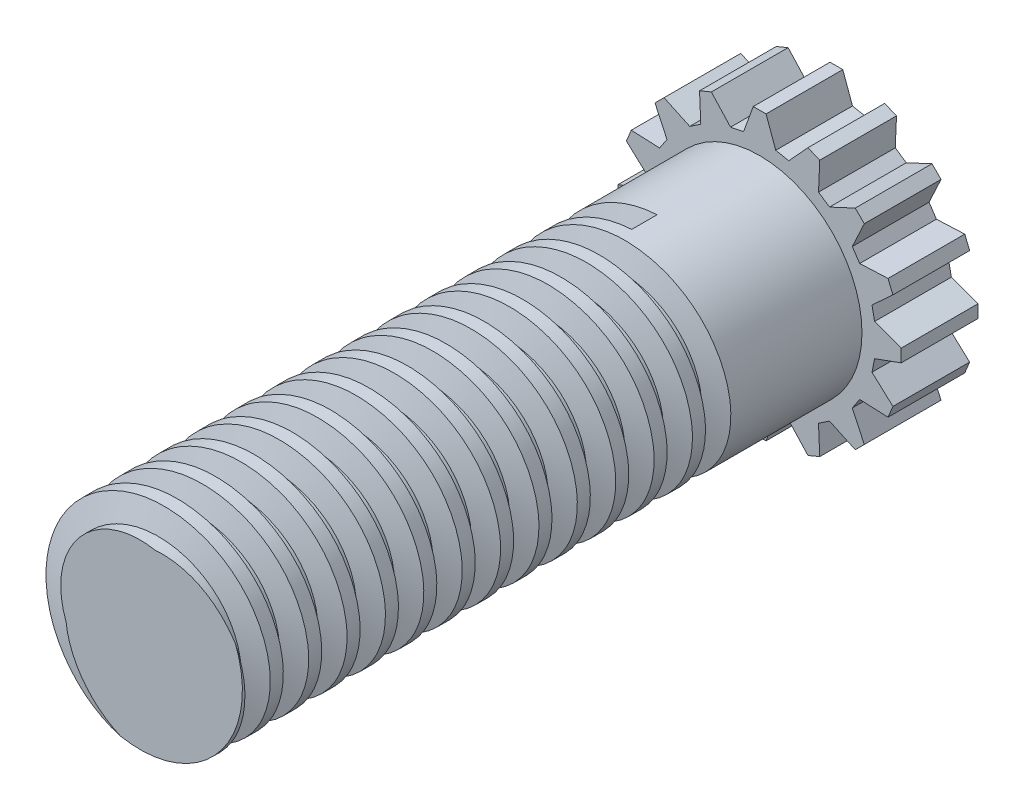
from build123d import *
from build123d.topology import SkipClean

# Parameters (mm, degrees)
SKETCH_1_R               = 4
EXTRUDE_1_DEPTH          = 30
EXTRUDE_START            = 5
SKETCH_4_R               = 4
EXTRUDE_2_DEPTH          = 5
SKETCH_5_R               = 4
EXTRUDE_3_DEPTH          = 5
SWEEP_1_PITCH            = 1.5
SKETCH_6_R               = 2
EXTRUDE_1_2_DEPTH        = 3
CUT_EXTRUDE_1_DEPTH      = 36.864400436
CUT_EXTRUDE_1_DEPTH_BACK = 36.864400436
SKETCH_8_W               = 23.396667725
SKETCH_8_H               = 18.619103895


with BuildPart() as part:
    # 草图1 → Extrude 1 (new body)
    with BuildSketch(Plane.XY):
        Circle(SKETCH_1_R)
    extrude(amount=EXTRUDE_1_DEPTH)

    # 草图4 → 拉伸2 (add)
    with BuildSketch(Plane(origin=(0, 0, 0), x_dir=(-1, 0, 0), z_dir=(0, 0, -1)).offset(EXTRUDE_START)):
        Circle(SKETCH_4_R)
    extrude(amount=-EXTRUDE_2_DEPTH)

    # 草图5 → 拉伸3 (add)
    with BuildSketch(Plane.XY.offset(30)):
        with Locations(Location((0, 0, 0), (0, 0, 180))):
            Circle(SKETCH_5_R)
    extrude(amount=EXTRUDE_3_DEPTH)

    # 切除-扫描1: the profile of 草图2 profile screwed along a right-hand helix of 20 turns, 6 arcs to a turn; built about Z, then put on its axis
    with SkipClean():  # the faces are left unmerged after this step: merging them gives an invalid solid
        sweep_1_z = Axis((0, 0, 0), (0, 0, 1))
        sweep_1_corners = [(4.0003, 0, 8.0385e-05), (4.0003, 0, -0.991234658), (3.1, 0, -0.75), (3.1, 0, -0.241154273)]
        with BuildLine(mode=Mode.PRIVATE) as sweep_1_profile:
            Line(sweep_1_corners[0], sweep_1_corners[1])
            Line(sweep_1_corners[1], sweep_1_corners[2])
            Line(sweep_1_corners[2], sweep_1_corners[3])
            Line(sweep_1_corners[3], sweep_1_corners[0])
        sweep_1_cap = Face(sweep_1_profile.wire())
        sweep_1_turn_angles = [0, 30, 60, 90, 120, 150, 180, 210, 240, 270, 300, 330, 360]
        sweep_1_turn_weights = [1, 0.8660254037844387, 1, 0.8660254037844387, 1, 0.8660254037844387, 1, 0.8660254037844387, 1, 0.8660254037844387, 1, 0.8660254037844387, 1]
        sweep_1_turn_rails = [Edge.make_bspline([Vector(p[0], p[1], 0).rotate(sweep_1_z, sweep_1_turn_angles[k]) / sweep_1_turn_weights[k] + Vector(0, 0, p[2] + SWEEP_1_PITCH * sweep_1_turn_angles[k] / 360) for k in range(13)], [0, 0, 0, 1, 1, 2, 2, 3, 3, 4, 4, 5, 5, 6, 6, 6], 2, sweep_1_turn_weights) for p in sweep_1_corners]
        sweep_1_turn_sides = [Face.make_surface_from_curves(sweep_1_turn_rails[p[0]], sweep_1_turn_rails[p[1]]) for p in [(0, 1), (1, 2), (2, 3), (3, 0)]]
        sweep_1 = Plane(origin=(0, 0, 0), x_dir=(0, 1, 0), z_dir=(0, 0, 1)) * Solid(Shell([*[p.moved(Location((0, 0, SWEEP_1_PITCH * i))) for i in range(20) for p in sweep_1_turn_sides], sweep_1_cap, sweep_1_cap.rotate(sweep_1_z, 7200).moved(Location((0, 0, SWEEP_1_PITCH * 7200 / 360)))]))
        add(sweep_1, mode=Mode.SUBTRACT)

    # 草图6 → Extrude 1 2 (add)
    with SkipClean():  # the faces are left unmerged after this step: merging them gives an invalid solid
        with BuildSketch(Plane(origin=(0, 0, -5), x_dir=(-1, 0, 0), z_dir=(0, 0, -1))):
            Polygon((-0.25, 5.534221656), (0.25, 5.534221656), (0.629149094, 4.492518082), (1.137954269, 4.39131044), (1.886885056, 5.208624974), (2.348824822, 5.017283258), (2.30047021, 3.909780571), (2.73181441, 3.621565591), (3.736508966, 4.090062357), (4.090062357, 3.736508966), (3.621565591, 2.73181441), (3.909780571, 2.30047021), (5.017283258, 2.348824822), (5.208624974, 1.886885056), (4.39131044, 1.137954269), (4.492518082, 0.629149094), (5.534221656, 0.25), (5.534221656, -0.25), (4.492518082, -0.629149094), (4.39131044, -1.137954269), (5.208624974, -1.886885056), (5.017283258, -2.348824822), (3.909780571, -2.30047021), (3.621565591, -2.73181441), (4.090062357, -3.736508966), (3.736508966, -4.090062357), (2.73181441, -3.621565591), (2.30047021, -3.909780571), (2.348824822, -5.017283258), (1.886885056, -5.208624974), (1.137954269, -4.39131044), (0.629149094, -4.492518082), (0.25, -5.534221656), (-0.25, -5.534221656), (-0.629149094, -4.492518082), (-1.137954269, -4.39131044), (-1.886885056, -5.208624974), (-2.348824822, -5.017283258), (-2.30047021, -3.909780571), (-2.73181441, -3.621565591), (-3.736508966, -4.090062357), (-4.090062357, -3.736508966), (-3.621565591, -2.73181441), (-3.909780571, -2.30047021), (-5.017283258, -2.348824822), (-5.208624974, -1.886885056), (-4.39131044, -1.137954269), (-4.492518082, -0.629149094), (-5.534221656, -0.25), (-5.534221656, 0.25), (-4.492518082, 0.629149094), (-4.39131044, 1.137954269), (-5.208624974, 1.886885056), (-5.017283258, 2.348824822), (-3.909780571, 2.30047021), (-3.621565591, 2.73181441), (-4.090062357, 3.736508966), (-3.736508966, 4.090062357), (-2.73181441, 3.621565591), (-2.30047021, 3.909780571), (-2.348824822, 5.017283258), (-1.886885056, 5.208624974), (-1.137954269, 4.39131044), (-0.629149094, 4.492518082), align=None)
            Circle(SKETCH_6_R, mode=Mode.SUBTRACT)
        extrude(amount=EXTRUDE_1_2_DEPTH)

    # 草图8 → 切除-拉伸1 (cut, two sides: drawn at the far end of the back side and taken through both)
    with SkipClean():  # the faces are left unmerged after this step: merging them gives an invalid solid
        with BuildSketch(Plane(origin=(0, 0, 0), x_dir=(0, 0, -1), z_dir=(1, 0, 0)).offset(-CUT_EXTRUDE_1_DEPTH_BACK)):
            with Locations((-30.913550406, 1.518104395)):
                Rectangle(SKETCH_8_W, SKETCH_8_H)
        extrude(amount=CUT_EXTRUDE_1_DEPTH + CUT_EXTRUDE_1_DEPTH_BACK, mode=Mode.SUBTRACT)


solid = part.part
